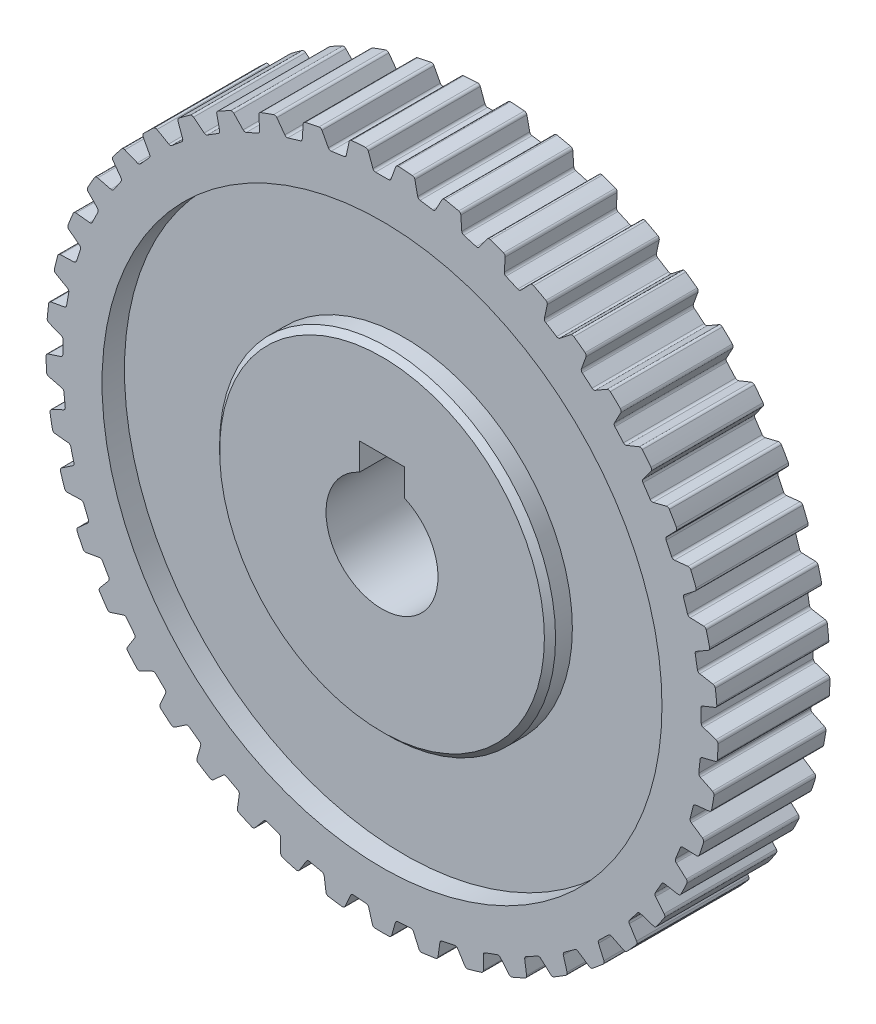
from build123d import *

# Parameters (mm, degrees)
SKETCH1_R           = 30
BOSS_EXTRUDE2_DEPTH = 5
CUT_EXTRUDE1_DEPTH  = 44.588989435
CIRPATTERN1_COUNT   = 45
SKETCH3_R           = 25
SKETCH3_R_2         = 15
CUT_EXTRUDE2_DEPTH  = 2
CHAMFER1_SIZE       = 0.5
FILLET1_R           = 0.25


with BuildPart() as part:
    # Sketch1 → Boss-Extrude2 (new, symmetric)
    with BuildSketch(Plane.XY):
        Circle(SKETCH1_R)
        with BuildLine():
            Line((-2, 7), (2, 7))
            Line((2, 7), (2, 4.582575695))
            ThreePointArc((2, 4.582575695), (0, -5), (-2, 4.582575695))
            Line((-2, 4.582575695), (-2, 7))
        make_face(mode=Mode.SUBTRACT)
    extrude(amount=BOSS_EXTRUDE2_DEPTH, both=True)

    # Sketch2 → Cut-Extrude1 (cut, through all)
    with BuildSketch(Plane.XY.offset(5)):
        with BuildLine():
            Line((-0.75, 28.5), (0.75, 28.5))
            Line((0.75, 28.5), (1.285919783, 29.972427501))
            ThreePointArc((1.285919783, 29.972427501), (0, 30.328503456), (-1.285919783, 29.972427501))
            Line((-1.285919783, 29.972427501), (-0.75, 28.5))
        make_face()
    cut_extrude1 = extrude(amount=-CUT_EXTRUDE1_DEPTH, mode=Mode.SUBTRACT)

    # CirPattern1: Cut-Extrude1 ×45 about axis
    cirpattern1_axis = Axis((0, 0, 5), (0, 0, 1))
    for i in range(1, CIRPATTERN1_COUNT):
        add(cut_extrude1.rotate(cirpattern1_axis, i * 360 / CIRPATTERN1_COUNT), mode=Mode.SUBTRACT)

    # Sketch3 → Cut-Extrude2 (cut)
    with BuildSketch(Plane.XY.offset(5)):
        Circle(SKETCH3_R)
        Circle(SKETCH3_R_2, mode=Mode.SUBTRACT)
    cut_extrude2 = extrude(amount=-CUT_EXTRUDE2_DEPTH, mode=Mode.SUBTRACT)

    # Mirror1: Cut-Extrude2 across plane
    add(cut_extrude2.mirror(Plane.XY), mode=Mode.SUBTRACT)

    # Chamfer1
    chamfer1_edges = [part.edges().sort_by_distance(p)[0] for p in [
        (-15, 0, 5),
        (-15, 0, -5),
    ]]
    chamfer(chamfer1_edges, length=CHAMFER1_SIZE)

    # Fillet1
    fillet1_edges = [part.edges().sort_by_distance(p)[0] for p in [
        (28.422270365, -2.233169782, 0),
        (29.942650626, -1.854096408, 0),
        (29.999047061, -0.2391138, 0),
        (28.508813193, 0.245092536, 0),
        (28.456463948, 1.744178776, 0),
        (29.909291155, 2.33115907, 0),
        (29.740376607, 3.938273644, 0),
        (28.197257094, 4.210367249, 0),
        (27.936784828, 5.687578878, 0),
        (29.293781353, 6.471041187, 0),
        (28.90284355, 8.039007072, 0),
        (27.33687346, 8.093691952, 0),
        (26.873347969, 9.520276727, 0),
        (28.108101418, 10.484971849, 0),
        (27.502749521, 11.983270371, 0),
        (25.94440868, 11.819482149, 0),
        (25.286851959, 13.167673218, 0),
        (26.375329261, 14.29482446, 0),
        (25.567345756, 15.694292943, 0),
        (24.046965495, 15.31521957, 0),
        (23.20817614, 16.558775928, 0),
        (24.129191322, 17.826444573, 0),
        (23.134302688, 19.099843956, 0),
        (21.681475481, 18.512863662, 0),
        (20.677779571, 19.6275809, 0),
        (21.413406121, 21.01109322, 0),
        (20.250976734, 22.133638231, 0),
        (18.893980208, 21.350175922, 0),
        (17.744913544, 22.314357336, 0),
        (18.280833326, 23.786784837, 0),
        (16.973488552, 24.736626415, 0),
        (15.738735103, 23.771931292, 0),
        (14.466662959, 24.566810189, 0),
        (14.792444905, 26.099493745, 0),
        (13.365630723, 26.858144303, 0),
        (12.277153421, 25.730993061, 0),
        (10.906835234, 26.341098025, 0),
        (11.01613837, 27.904205694, 0),
        (9.497626095, 28.456898963, 0),
        (8.576610913, 27.189230317, 0),
        (7.134718369, 27.602686351, 0),
        (7.025415233, 29.16579402, 0),
        (5.444760978, 29.501772453, 0),
        (4.709134429, 28.118260133, 0),
        (3.223732326, 28.327019785, 0),
        (2.897950379, 29.859703341, 0),
        (1.285919783, 29.972427501, 0),
        (0.75, 28.5, 0),
        (-0.75, 28.5, 0),
        (-1.285919783, 29.972427501, 0),
        (-2.897950379, 29.859703341, 0),
        (-3.223732326, 28.327019785, 0),
        (-4.709134429, 28.118260133, 0),
        (-7.025415233, 29.16579402, 0),
        (-7.134718369, 27.602686351, 0),
        (-8.576610913, 27.189230317, 0),
        (-9.497626095, 28.456898963, 0),
        (-11.01613837, 27.904205694, 0),
        (-10.906835234, 26.341098025, 0),
        (-12.277153421, 25.730993061, 0),
        (-13.365630723, 26.858144303, 0),
        (-14.792444905, 26.099493745, 0),
        (-14.466662959, 24.566810189, 0),
        (-15.738735103, 23.771931292, 0),
        (-16.973488552, 24.736626415, 0),
        (-18.280833326, 23.786784837, 0),
        (-17.744913544, 22.314357336, 0),
        (-18.893980208, 21.350175922, 0),
        (-20.250976734, 22.133638231, 0),
        (-21.413406121, 21.01109322, 0),
        (-20.677779571, 19.6275809, 0),
        (-21.681475481, 18.512863662, 0),
        (-23.134302688, 19.099843956, 0),
        (-24.129191322, 17.826444573, 0),
        (-23.20817614, 16.558775928, 0),
        (-24.046965495, 15.315219569, 0),
        (-25.567345756, 15.694292943, 0),
        (-26.375329261, 14.29482446, 0),
        (-25.286851959, 13.167673218, 0),
        (-25.94440868, 11.819482149, 0),
        (-27.502749521, 11.983270371, 0),
        (-28.108101418, 10.484971849, 0),
        (-26.873347969, 9.520276727, 0),
        (-27.33687346, 8.093691952, 0),
        (-28.90284355, 8.039007072, 0),
        (-29.293781353, 6.471041187, 0),
        (-27.936784828, 5.687578878, 0),
        (-28.197257094, 4.210367249, 0),
        (-29.740376607, 3.938273644, 0),
        (-29.909291155, 2.33115907, 0),
        (-28.456463948, 1.744178776, 0),
        (-28.508813193, 0.245092536, 0),
        (-29.999047061, -0.2391138, 0),
        (-29.942650626, -1.854096408, 0),
        (-28.422270365, -2.233169782, 0),
        (-28.265477671, -3.724952625, 0),
        (-29.673820188, -4.411847167, 0),
        (-29.393210462, -6.003264007, 0),
        (-27.834869621, -6.16705223, 0),
        (-27.471986777, -7.622495819, 0),
        (-28.771026159, -8.498708946, 0),
        (-28.27166489, -10.035584902, 0),
        (-26.7056948, -9.980900021, 0),
        (-26.14378491, -11.371675803, 0),
        (-27.308236832, -12.420153023, 0),
        (-26.59984352, -13.872574552, 0),
        (-25.056724008, -13.600480947, 0),
        (-24.306724008, -14.899519053, 0),
        (-25.313923738, -16.099852949, 0),
        (-24.410286453, -17.439550318, 0),
        (-22.920052584, -16.955343982, 0),
        (-21.996560371, -18.137360112, 0),
        (-22.826903912, -19.466187551, 0),
        (-21.745610926, -20.667085074, 0),
        (-20.337268408, -19.980190532, 0),
        (-19.258258708, -21.022178087, 0),
        (-19.895584367, -22.453634955, 0),
        (-18.657681818, -23.492358527, 0),
        (-17.358642436, -22.6161454, 0),
        (-16.145116945, -23.497823279, 0),
        (-16.577019903, -25.004047895, 0),
        (-15.206602156, -25.860379944, 0),
        (-14.042150234, -24.811902724, 0),
        (-12.717728845, -25.516110069, 0),
        (-12.935802603, -27.067785484, 0),
        (-11.45954328, -27.725058482, 0),
        (-10.45234355, -26.524724585, 0),
        (-9.042804619, -27.0377548, 0),
        (-9.042804619, -28.604679418, 0),
        (-7.48943743, -29.050100292, 0),
        (-6.659093889, -27.721272853, 0),
        (-5.191872488, -28.033140389, 0),
        (-4.97379873, -29.584815805, 0),
        (-3.373558199, -29.809714945, 0),
        (-2.736232539, -28.378258077, 0),
        (-1.239886464, -28.482892788, 0),
        (-0.807983505, -29.989117404, 0),
        (0.807983505, -29.989117404, 0),
        (1.239886464, -28.482892788, 0),
        (2.736232539, -28.378258077, 0),
        (3.373558199, -29.809714945, 0),
        (4.97379873, -29.584815805, 0),
        (5.191872488, -28.033140389, 0),
        (6.659093889, -27.721272853, 0),
        (7.48943743, -29.050100292, 0),
        (9.042804619, -28.604679418, 0),
        (9.042804619, -27.0377548, 0),
        (10.45234355, -26.524724585, 0),
        (11.45954328, -27.725058482, 0),
        (12.935802603, -27.067785484, 0),
        (12.717728845, -25.516110069, 0),
        (14.042150234, -24.811902724, 0),
        (15.206602156, -25.860379944, 0),
        (16.577019903, -25.004047895, 0),
        (16.145116945, -23.497823279, 0),
        (17.358642436, -22.6161454, 0),
        (18.657681818, -23.492358527, 0),
        (19.895584367, -22.453634955, 0),
        (19.258258708, -21.022178087, 0),
        (20.337268408, -19.980190532, 0),
        (21.745610926, -20.667085074, 0),
        (22.826903912, -19.466187551, 0),
        (21.996560371, -18.137360112, 0),
        (22.920052584, -16.955343982, 0),
        (24.410286453, -17.439550318, 0),
        (25.313923738, -16.099852949, 0),
        (24.306724008, -14.899519053, 0),
        (25.056724008, -13.600480947, 0),
        (26.59984352, -13.872574552, 0),
        (27.308236832, -12.420153023, 0),
        (26.14378491, -11.371675803, 0),
        (26.7056948, -9.980900021, 0),
        (28.27166489, -10.035584902, 0),
        (28.771026159, -8.498708946, 0),
        (27.471986777, -7.622495819, 0),
        (27.834869621, -6.16705223, 0),
        (29.393210462, -6.003264007, 0),
        (29.673820188, -4.411847167, 0),
        (28.265477671, -3.724952625, 0),
        (-5.444760978, 29.501772453, 0),
    ]]
    fillet(fillet1_edges, radius=FILLET1_R)


solid = part.part
